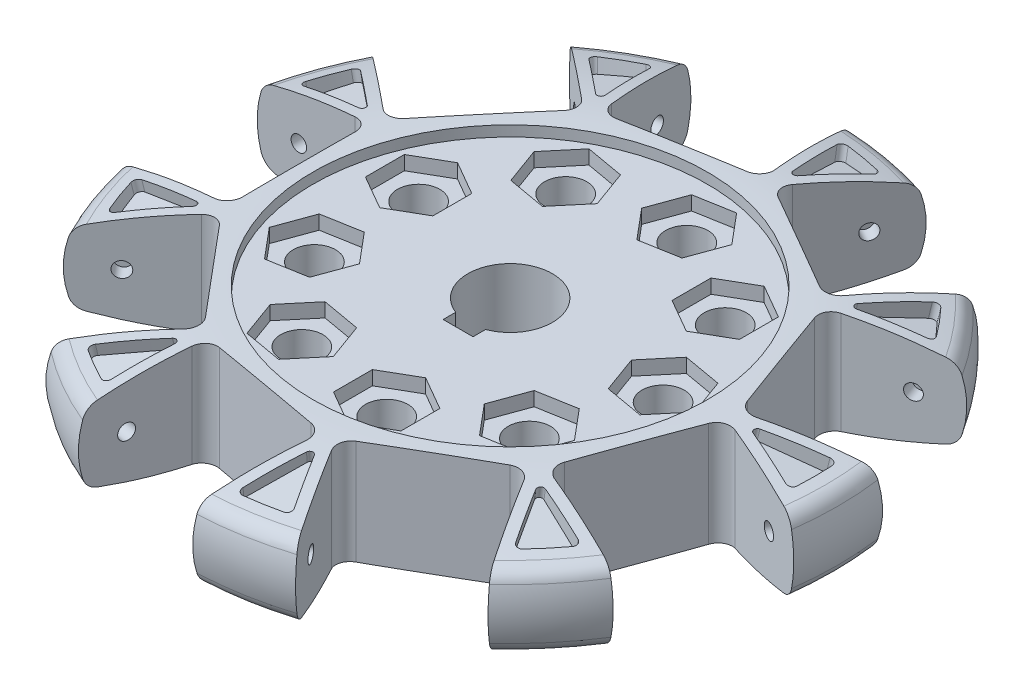
from build123d import *

# Parameters (mm, degrees)
CUT_EXTRUDE_1_DEPTH                = 69.974548261
PATTERN_CIRCULAR_1_COUNT           = 9
CUT_EXTRUDE_3_DEPTH                = 2
PATTERN_CIRCULAR_2_COUNT           = 9
PATTERN_CIRCULAR_2_COPY_1_DEPTH    = 2
PATTERN_CIRCULAR_2_COPY_2_DEPTH    = 2
PATTERN_CIRCULAR_2_COPY_3_DEPTH    = 2
PATTERN_CIRCULAR_2_COPY_4_DEPTH    = 2
PATTERN_CIRCULAR_2_COPY_5_DEPTH    = 2
PATTERN_CIRCULAR_2_COPY_6_DEPTH    = 2
PATTERN_CIRCULAR_2_COPY_7_DEPTH    = 2
PATTERN_CIRCULAR_2_COPY_8_DEPTH    = 2
SKETCH_6_R                         = 3
CUT_EXTRUDE_4_DEPTH                = 68.778705687
CUT_EXTRUDE_5_DEPTH                = 2
PATTERN_CIRCULAR_3_COUNT           = 9
CUT_EXTRUDE_6_DEPTH                = 68.778705687
CUT_EXTRUDE_6_DEPTH_BACK           = 68.778705687
SKETCH_8_W                         = 4.246385544
SKETCH_8_H                         = 1.783594452
SKETCH_9_R                         = 1.1
CUT_EXTRUDE_7_DEPTH                = 2
PATTERN_CIRCULAR_4_COUNT           = 9
PATTERN_CIRCULAR_4_COPY_1_SKETCH_R = 1.1
PATTERN_CIRCULAR_4_COPY_1_DEPTH    = 2
PATTERN_CIRCULAR_4_COPY_2_SKETCH_R = 1.1
PATTERN_CIRCULAR_4_COPY_2_DEPTH    = 2
PATTERN_CIRCULAR_4_COPY_3_SKETCH_R = 1.1
PATTERN_CIRCULAR_4_COPY_3_DEPTH    = 2
PATTERN_CIRCULAR_4_COPY_4_SKETCH_R = 1.1
PATTERN_CIRCULAR_4_COPY_4_DEPTH    = 2
PATTERN_CIRCULAR_4_COPY_5_SKETCH_R = 1.1
PATTERN_CIRCULAR_4_COPY_5_DEPTH    = 2
PATTERN_CIRCULAR_4_COPY_6_SKETCH_R = 1.1
PATTERN_CIRCULAR_4_COPY_6_DEPTH    = 2
PATTERN_CIRCULAR_4_COPY_7_SKETCH_R = 1.1
PATTERN_CIRCULAR_4_COPY_7_DEPTH    = 2
PATTERN_CIRCULAR_4_COPY_8_SKETCH_R = 1.1
PATTERN_CIRCULAR_4_COPY_8_DEPTH    = 2


with BuildPart() as part:
    # 草图1 → 旋转1 (revolve)
    with BuildSketch(Plane.XY):
        with BuildLine():
            Line((-6, 6.0015), (-6, -6.0015))
            Line((-6, -6.0015), (-28, -6.0015))
            Line((-28, -6.0015), (-28, -7.5))
            add(Edge.make_bspline(
                [(-28, -7.5), (-33.612534544, -7.506389819), (-39.182169701, -6.79075308), (-44.69778482, -5.353102439)],
                knots=[0, 0, 0, 0, 0.926994308, 0.926994308, 0.926994308, 0.926994308], degree=3))
            ThreePointArc((-44.69778482, -5.353102439), (-45.812153034, -4.7233276), (-46.46758639, -3.623855009))
            add(Edge.make_bspline(
                [(-46.473404583, 3.624485081), (-46.815442106, 2.431078638), (-47.156494807, -0.006033981), (-46.811568076, -2.419267682), (-46.46758639, -3.623855009)],
                knots=[0.139652253, 0.139652253, 0.139652253, 0.139652253, 0.501009303, 0.862385501, 0.862385501, 0.862385501, 0.862385501], degree=3))
            ThreePointArc((-46.473404583, 3.624485081), (-45.817862343, 4.722392286), (-44.70451169, 5.351348709))
            add(Edge.make_bspline(
                [(-28, 7.5), (-33.614833906, 7.506392396), (-39.186695198, 6.7901711), (-44.70451169, 5.351348709)],
                knots=[0, 0, 0, 0, 0.927371165, 0.927371165, 0.927371165, 0.927371165], degree=3))
            Line((-28, 7.5), (-28, 6.0015))
            Line((-28, 6.0015), (-6, 6.0015))
        make_face()
    revolve(axis=Axis((0, 18.348706493, 0), (0, -1, 0)))

    # 草图3 → 切除-拉伸1 (cut, through all)
    with BuildSketch(Plane(origin=(0, 11.0015, 0), x_dir=(1, 0, 0), z_dir=(0, 1, 0))):
        with BuildLine():
            Line((-46.435439053, 10), (-32, 10))
            ThreePointArc((-32, 10), (-30.585786438, 9.414213562), (-30, 8))
            Line((-30, 8), (-30, -8))
            ThreePointArc((-30, -8), (-30.585786438, -9.414213562), (-32, -10))
            Line((-32, -10), (-46.435439053, -10))
            ThreePointArc((-46.435439053, -10), (-47.5, 0), (-46.435439053, 10))
        make_face()
    cut_extrude_1 = extrude(amount=-CUT_EXTRUDE_1_DEPTH, mode=Mode.SUBTRACT)

    # 阵列(圆周)1: 切除-拉伸1 ×9 about axis
    pattern_circular_1_axis = Axis((0, 18.348706493, 0), (0, 1, 0))
    for i in range(1, PATTERN_CIRCULAR_1_COUNT):
        add(cut_extrude_1.rotate(pattern_circular_1_axis, i * 360 / PATTERN_CIRCULAR_1_COUNT), mode=Mode.SUBTRACT)

    # 草图5 → 切除-拉伸3 (cut)
    with BuildSketch(Plane(origin=(-2.912473789, 13.881841171, 0), x_dir=(-0.9786919477616355, -0.20533404828848112, -3.546150752329598e-15), z_dir=(-0.20533404828848112, 0.9786919477616355, -3.491481338843133e-15))):
        with BuildLine():
            Line((38.704667926, -11.5), (30.858037974, -11.5))
            ThreePointArc((30.858037974, -11.5), (30.374644137, -11.838841318), (30.528298333, -12.408818009))
            add(Edge.make_bspline(
                [(30.528298333, -12.408818009), (32.538191397, -14.088385517), (34.566082604, -15.757277023), (36.602034834, -17.407382848)],
                knots=[0.103336943, 0.103336943, 0.103336943, 0.103336943, 0.906001703, 0.906001703, 0.906001703, 0.906001703], degree=3))
            ThreePointArc((36.602034834, -17.407382848), (37.212548342, -17.542670381), (37.687590478, -17.136020125))
            add(Edge.make_bspline(
                [(37.687590478, -17.136020125), (38.013997426, -16.363529197), (38.622401583, -14.799746817), (39.140499829, -13.202223119), (39.376438976, -12.396783272)],
                knots=[0.134677988, 0.134677988, 0.134677988, 0.134677988, 0.5, 0.86497285, 0.86497285, 0.86497285, 0.86497285], degree=3))
            ThreePointArc((39.376438976, -12.396783272), (39.264912645, -11.78032649), (38.704667926, -11.5))
        make_face()
    cut_extrude_3 = extrude(amount=-CUT_EXTRUDE_3_DEPTH, mode=Mode.SUBTRACT)

    # 镜向1: 切除-拉伸3 across plane
    add(cut_extrude_3.mirror(Plane.ZX), mode=Mode.SUBTRACT)

    # 阵列(圆周)2: 切除-拉伸3 ×9 about axis
    pattern_circular_2_axis = Axis((0, 18.348706493, 0), (0, 1, 0))
    for i in range(1, PATTERN_CIRCULAR_2_COUNT):
        add(cut_extrude_3.rotate(pattern_circular_2_axis, i * 360 / PATTERN_CIRCULAR_2_COUNT), mode=Mode.SUBTRACT)

    # 阵列(圆周)2 copy 1 sketch → 阵列(圆周)2 copy 1 (cut)
    with BuildSketch(Plane(origin=(-2.231084362, -13.881841171, 1.872102065), x_dir=(-0.7497215281080923, 0.20533404828848112, 0.6290910577211624), z_dir=(-0.1572950066745171, -0.9786919477616355, 0.13198618208661053))):
        with BuildLine():
            Line((38.704667926, 11.5), (30.858037974, 11.5))
            ThreePointArc((30.858037974, 11.5), (30.374644137, 11.838841318), (30.528298333, 12.408818009))
            add(Edge.make_bspline(
                [(30.528298333, 12.408818009), (32.538191397, 14.088385517), (34.566082604, 15.757277023), (36.602034834, 17.407382848)],
                knots=[0.103336943, 0.103336943, 0.103336943, 0.103336943, 0.906001703, 0.906001703, 0.906001703, 0.906001703], degree=3))
            ThreePointArc((36.602034834, 17.407382848), (37.212548342, 17.542670381), (37.687590478, 17.136020125))
            add(Edge.make_bspline(
                [(37.687590478, 17.136020125), (38.013997426, 16.363529197), (38.622401583, 14.799746817), (39.140499829, 13.202223119), (39.376438976, 12.396783272)],
                knots=[0.134677988, 0.134677988, 0.134677988, 0.134677988, 0.5, 0.86497285, 0.86497285, 0.86497285, 0.86497285], degree=3))
            ThreePointArc((39.376438976, 12.396783272), (39.264912645, 11.78032649), (38.704667926, 11.5))
        make_face()
    extrude(amount=-PATTERN_CIRCULAR_2_COPY_1_DEPTH, mode=Mode.SUBTRACT)

    # 阵列(圆周)2 copy 2 sketch → 阵列(圆周)2 copy 2 (cut)
    with BuildSketch(Plane(origin=(-0.505745766, -13.881841171, 2.868226768), x_dir=(-0.16994807322611016, 0.20533404828848112, 0.9638234179662768), z_dir=(-0.03565588329827168, -0.9786919477616355, 0.2022145627118787))):
        with BuildLine():
            Line((38.704667926, 11.5), (30.858037974, 11.5))
            ThreePointArc((30.858037974, 11.5), (30.374644137, 11.838841318), (30.528298333, 12.408818009))
            add(Edge.make_bspline(
                [(30.528298333, 12.408818009), (32.538191397, 14.088385517), (34.566082604, 15.757277023), (36.602034834, 17.407382848)],
                knots=[0.103336943, 0.103336943, 0.103336943, 0.103336943, 0.906001703, 0.906001703, 0.906001703, 0.906001703], degree=3))
            ThreePointArc((36.602034834, 17.407382848), (37.212548342, 17.542670381), (37.687590478, 17.136020125))
            add(Edge.make_bspline(
                [(37.687590478, 17.136020125), (38.013997426, 16.363529197), (38.622401583, 14.799746817), (39.140499829, 13.202223119), (39.376438976, 12.396783272)],
                knots=[0.134677988, 0.134677988, 0.134677988, 0.134677988, 0.5, 0.86497285, 0.86497285, 0.86497285, 0.86497285], degree=3))
            ThreePointArc((39.376438976, 12.396783272), (39.264912645, 11.78032649), (38.704667926, 11.5))
        make_face()
    extrude(amount=-PATTERN_CIRCULAR_2_COPY_2_DEPTH, mode=Mode.SUBTRACT)

    # 阵列(圆周)2 copy 3 sketch → 阵列(圆周)2 copy 3 (cut)
    with BuildSketch(Plane(origin=(1.456236894, -13.881841171, 2.522276289), x_dir=(0.48934597388081447, 0.20533404828848112, 0.8475720892408509), z_dir=(0.10266702414423749, -0.9786919477616355, 0.17782450207972705))):
        with BuildLine():
            Line((38.704667926, 11.5), (30.858037974, 11.5))
            ThreePointArc((30.858037974, 11.5), (30.374644137, 11.838841318), (30.528298333, 12.408818009))
            add(Edge.make_bspline(
                [(30.528298333, 12.408818009), (32.538191397, 14.088385517), (34.566082604, 15.757277023), (36.602034834, 17.407382848)],
                knots=[0.103336943, 0.103336943, 0.103336943, 0.103336943, 0.906001703, 0.906001703, 0.906001703, 0.906001703], degree=3))
            ThreePointArc((36.602034834, 17.407382848), (37.212548342, 17.542670381), (37.687590478, 17.136020125))
            add(Edge.make_bspline(
                [(37.687590478, 17.136020125), (38.013997426, 16.363529197), (38.622401583, 14.799746817), (39.140499829, 13.202223119), (39.376438976, 12.396783272)],
                knots=[0.134677988, 0.134677988, 0.134677988, 0.134677988, 0.5, 0.86497285, 0.86497285, 0.86497285, 0.86497285], degree=3))
            ThreePointArc((39.376438976, 12.396783272), (39.264912645, 11.78032649), (38.704667926, 11.5))
        make_face()
    extrude(amount=-PATTERN_CIRCULAR_2_COPY_3_DEPTH, mode=Mode.SUBTRACT)

    # 阵列(圆周)2 copy 4 sketch → 阵列(圆周)2 copy 4 (cut)
    with BuildSketch(Plane(origin=(2.736830128, -13.881841171, 0.996124703), x_dir=(0.9196696013341953, 0.20533404828848112, 0.33473236024511593), z_dir=(0.19295088997278187, -0.9786919477616355, 0.0702283806252694))):
        with BuildLine():
            Line((38.704667926, 11.5), (30.858037974, 11.5))
            ThreePointArc((30.858037974, 11.5), (30.374644137, 11.838841318), (30.528298333, 12.408818009))
            add(Edge.make_bspline(
                [(30.528298333, 12.408818009), (32.538191397, 14.088385517), (34.566082604, 15.757277023), (36.602034834, 17.407382848)],
                knots=[0.103336943, 0.103336943, 0.103336943, 0.103336943, 0.906001703, 0.906001703, 0.906001703, 0.906001703], degree=3))
            ThreePointArc((36.602034834, 17.407382848), (37.212548342, 17.542670381), (37.687590478, 17.136020125))
            add(Edge.make_bspline(
                [(37.687590478, 17.136020125), (38.013997426, 16.363529197), (38.622401583, 14.799746817), (39.140499829, 13.202223119), (39.376438976, 12.396783272)],
                knots=[0.134677988, 0.134677988, 0.134677988, 0.134677988, 0.5, 0.86497285, 0.86497285, 0.86497285, 0.86497285], degree=3))
            ThreePointArc((39.376438976, 12.396783272), (39.264912645, 11.78032649), (38.704667926, 11.5))
        make_face()
    extrude(amount=-PATTERN_CIRCULAR_2_COPY_4_DEPTH, mode=Mode.SUBTRACT)

    # 阵列(圆周)2 copy 5 sketch → 阵列(圆周)2 copy 5 (cut)
    with BuildSketch(Plane(origin=(2.736830128, -13.881841171, -0.996124703), x_dir=(0.9196696013341978, 0.20533404828848112, -0.33473236024510905), z_dir=(0.19295088997278428, -0.9786919477616355, -0.0702283806252628))):
        with BuildLine():
            Line((38.704667926, 11.5), (30.858037974, 11.5))
            ThreePointArc((30.858037974, 11.5), (30.374644137, 11.838841318), (30.528298333, 12.408818009))
            add(Edge.make_bspline(
                [(30.528298333, 12.408818009), (32.538191397, 14.088385517), (34.566082604, 15.757277023), (36.602034834, 17.407382848)],
                knots=[0.103336943, 0.103336943, 0.103336943, 0.103336943, 0.906001703, 0.906001703, 0.906001703, 0.906001703], degree=3))
            ThreePointArc((36.602034834, 17.407382848), (37.212548342, 17.542670381), (37.687590478, 17.136020125))
            add(Edge.make_bspline(
                [(37.687590478, 17.136020125), (38.013997426, 16.363529197), (38.622401583, 14.799746817), (39.140499829, 13.202223119), (39.376438976, 12.396783272)],
                knots=[0.134677988, 0.134677988, 0.134677988, 0.134677988, 0.5, 0.86497285, 0.86497285, 0.86497285, 0.86497285], degree=3))
            ThreePointArc((39.376438976, 12.396783272), (39.264912645, 11.78032649), (38.704667926, 11.5))
        make_face()
    extrude(amount=-PATTERN_CIRCULAR_2_COPY_5_DEPTH, mode=Mode.SUBTRACT)

    # 阵列(圆周)2 copy 6 sketch → 阵列(圆周)2 copy 6 (cut)
    with BuildSketch(Plane(origin=(1.456236894, -13.881841171, -2.522276289), x_dir=(0.48934597388082124, 0.20533404828848112, -0.847572089240847), z_dir=(0.10266702414424368, -0.9786919477616355, -0.17782450207972347))):
        with BuildLine():
            Line((38.704667926, 11.5), (30.858037974, 11.5))
            ThreePointArc((30.858037974, 11.5), (30.374644137, 11.838841318), (30.528298333, 12.408818009))
            add(Edge.make_bspline(
                [(30.528298333, 12.408818009), (32.538191397, 14.088385517), (34.566082604, 15.757277023), (36.602034834, 17.407382848)],
                knots=[0.103336943, 0.103336943, 0.103336943, 0.103336943, 0.906001703, 0.906001703, 0.906001703, 0.906001703], degree=3))
            ThreePointArc((36.602034834, 17.407382848), (37.212548342, 17.542670381), (37.687590478, 17.136020125))
            add(Edge.make_bspline(
                [(37.687590478, 17.136020125), (38.013997426, 16.363529197), (38.622401583, 14.799746817), (39.140499829, 13.202223119), (39.376438976, 12.396783272)],
                knots=[0.134677988, 0.134677988, 0.134677988, 0.134677988, 0.5, 0.86497285, 0.86497285, 0.86497285, 0.86497285], degree=3))
            ThreePointArc((39.376438976, 12.396783272), (39.264912645, 11.78032649), (38.704667926, 11.5))
        make_face()
    extrude(amount=-PATTERN_CIRCULAR_2_COPY_6_DEPTH, mode=Mode.SUBTRACT)

    # 阵列(圆周)2 copy 7 sketch → 阵列(圆周)2 copy 7 (cut)
    with BuildSketch(Plane(origin=(-0.505745766, -13.881841171, -2.868226768), x_dir=(-0.16994807322610272, 0.20533404828848112, -0.9638234179662782), z_dir=(-0.035655883298264704, -0.9786919477616355, -0.20221456271187993))):
        with BuildLine():
            Line((38.704667926, 11.5), (30.858037974, 11.5))
            ThreePointArc((30.858037974, 11.5), (30.374644137, 11.838841318), (30.528298333, 12.408818009))
            add(Edge.make_bspline(
                [(30.528298333, 12.408818009), (32.538191397, 14.088385517), (34.566082604, 15.757277023), (36.602034834, 17.407382848)],
                knots=[0.103336943, 0.103336943, 0.103336943, 0.103336943, 0.906001703, 0.906001703, 0.906001703, 0.906001703], degree=3))
            ThreePointArc((36.602034834, 17.407382848), (37.212548342, 17.542670381), (37.687590478, 17.136020125))
            add(Edge.make_bspline(
                [(37.687590478, 17.136020125), (38.013997426, 16.363529197), (38.622401583, 14.799746817), (39.140499829, 13.202223119), (39.376438976, 12.396783272)],
                knots=[0.134677988, 0.134677988, 0.134677988, 0.134677988, 0.5, 0.86497285, 0.86497285, 0.86497285, 0.86497285], degree=3))
            ThreePointArc((39.376438976, 12.396783272), (39.264912645, 11.78032649), (38.704667926, 11.5))
        make_face()
    extrude(amount=-PATTERN_CIRCULAR_2_COPY_7_DEPTH, mode=Mode.SUBTRACT)

    # 阵列(圆周)2 copy 8 sketch → 阵列(圆周)2 copy 8 (cut)
    with BuildSketch(Plane(origin=(-2.231084362, -13.881841171, -1.872102065), x_dir=(-0.7497215281080875, 0.20533404828848112, -0.629091057721168), z_dir=(-0.15729500667451257, -0.9786919477616355, -0.13198618208661594))):
        with BuildLine():
            Line((38.704667926, 11.5), (30.858037974, 11.5))
            ThreePointArc((30.858037974, 11.5), (30.374644137, 11.838841318), (30.528298333, 12.408818009))
            add(Edge.make_bspline(
                [(30.528298333, 12.408818009), (32.538191397, 14.088385517), (34.566082604, 15.757277023), (36.602034834, 17.407382848)],
                knots=[0.103336943, 0.103336943, 0.103336943, 0.103336943, 0.906001703, 0.906001703, 0.906001703, 0.906001703], degree=3))
            ThreePointArc((36.602034834, 17.407382848), (37.212548342, 17.542670381), (37.687590478, 17.136020125))
            add(Edge.make_bspline(
                [(37.687590478, 17.136020125), (38.013997426, 16.363529197), (38.622401583, 14.799746817), (39.140499829, 13.202223119), (39.376438976, 12.396783272)],
                knots=[0.134677988, 0.134677988, 0.134677988, 0.134677988, 0.5, 0.86497285, 0.86497285, 0.86497285, 0.86497285], degree=3))
            ThreePointArc((39.376438976, 12.396783272), (39.264912645, 11.78032649), (38.704667926, 11.5))
        make_face()
    extrude(amount=-PATTERN_CIRCULAR_2_COPY_8_DEPTH, mode=Mode.SUBTRACT)

    # 草图6 → 切除-拉伸4 (cut, through all)
    with BuildSketch(Plane(origin=(0, 6.0015, 0), x_dir=(1, 0, 0), z_dir=(0, 1, 0))):
        with Locations((3.800515938, -21.328883195)):
            Circle(SKETCH_6_R)
    cut_extrude_4 = extrude(amount=-CUT_EXTRUDE_4_DEPTH, mode=Mode.SUBTRACT)

    # 草图7 → 切除-拉伸5 (cut)
    with BuildSketch(Plane(origin=(0, 6.0015, 0), x_dir=(1, 0, 0), z_dir=(0, 1, 0))):
        Polygon((-0.984274418, -24.091383195), (3.800515938, -26.853883195), (8.585306294, -24.091383195), (8.585306294, -18.566383195), (3.800515938, -15.803883195), (-0.984274418, -18.566383195), align=None)
    cut_extrude_5 = extrude(amount=-CUT_EXTRUDE_5_DEPTH, mode=Mode.SUBTRACT)

    # 阵列(圆周)3: 切除-拉伸4, 切除-拉伸5 ×9 about axis
    pattern_circular_3_axis = Axis((0, 18.348706493, 0), (0, 1, 0))
    add([cut_extrude_4.rotate(pattern_circular_3_axis, i * 360 / PATTERN_CIRCULAR_3_COUNT) for i in range(1, PATTERN_CIRCULAR_3_COUNT)], mode=Mode.SUBTRACT)
    add([cut_extrude_5.rotate(pattern_circular_3_axis, i * 360 / PATTERN_CIRCULAR_3_COUNT) for i in range(1, PATTERN_CIRCULAR_3_COUNT)], mode=Mode.SUBTRACT)

    # 草图8 → 切除-拉伸6 (cut, two sides: drawn at the far end of the back side and taken through both)
    with BuildSketch(Plane(origin=(0, 6.0015, 0), x_dir=(1, 0, 0), z_dir=(0, 1, 0)).offset(-CUT_EXTRUDE_6_DEPTH_BACK)):
        with Locations((0, -6.503575238)):
            Rectangle(SKETCH_8_W, SKETCH_8_H)
    extrude(amount=CUT_EXTRUDE_6_DEPTH + CUT_EXTRUDE_6_DEPTH_BACK, mode=Mode.SUBTRACT)

    # 草图9 → 切除-拉伸7 (cut)
    with BuildSketch(Plane(origin=(9.84807753, 0, 1.736481777), x_dir=(-0.17364817766693996, 0, 0.9848077530122064), z_dir=(-0.9848077530122064, 0, -0.17364817766693996))):
        with Locations((40, 0)):
            Circle(SKETCH_9_R)
    cut_extrude_7 = extrude(amount=-CUT_EXTRUDE_7_DEPTH, mode=Mode.SUBTRACT)

    # 镜向5: 切除-拉伸7 across plane
    add(cut_extrude_7.mirror(Plane(origin=(0, 0, 0), x_dir=(-0.17364817766694024, 0, 0.9848077530122062), z_dir=(-0.9848077530122064, 0, -0.17364817766694024))), mode=Mode.SUBTRACT)

    # 阵列(圆周)4: 切除-拉伸7 ×9 about axis
    pattern_circular_4_axis = Axis((0, 18.348706493, 0), (0, 1, 0))
    for i in range(1, PATTERN_CIRCULAR_4_COUNT):
        add(cut_extrude_7.rotate(pattern_circular_4_axis, i * 360 / PATTERN_CIRCULAR_4_COUNT), mode=Mode.SUBTRACT)

    # 阵列(圆周)4 copy 1 sketch → 阵列(圆周)4 copy 1 (cut)
    with BuildSketch(Plane(origin=(-8.660254038, 0, 5), x_dir=(0.499999999999991, 0, 0.8660254037844437), z_dir=(0.866025403784444, 0, -0.4999999999999911))):
        with Locations((40, 0)):
            Circle(PATTERN_CIRCULAR_4_COPY_1_SKETCH_R)
    extrude(amount=-PATTERN_CIRCULAR_4_COPY_1_DEPTH, mode=Mode.SUBTRACT)

    # 阵列(圆周)4 copy 2 sketch → 阵列(圆周)4 copy 2 (cut)
    with BuildSketch(Plane(origin=(-3.420201433, 0, 9.396926208), x_dir=(0.9396926207859049, 0, 0.34202014332567854), z_dir=(0.34202014332567854, 0, -0.9396926207859051))):
        with Locations((40, 0)):
            Circle(PATTERN_CIRCULAR_4_COPY_2_SKETCH_R)
    extrude(amount=-PATTERN_CIRCULAR_4_COPY_2_DEPTH, mode=Mode.SUBTRACT)

    # 阵列(圆周)4 copy 3 sketch → 阵列(圆周)4 copy 3 (cut)
    with BuildSketch(Plane(origin=(3.420201433, 0, 9.396926208), x_dir=(0.939692620785912, 0, -0.34202014332565883), z_dir=(-0.3420201433256589, 0, -0.9396926207859122))):
        with Locations((40, 0)):
            Circle(PATTERN_CIRCULAR_4_COPY_3_SKETCH_R)
    extrude(amount=-PATTERN_CIRCULAR_4_COPY_3_DEPTH, mode=Mode.SUBTRACT)

    # 阵列(圆周)4 copy 4 sketch → 阵列(圆周)4 copy 4 (cut)
    with BuildSketch(Plane(origin=(8.660254038, 0, 5), x_dir=(0.500000000000009, 0, -0.8660254037844334), z_dir=(-0.8660254037844336, 0, -0.5000000000000091))):
        with Locations((40, 0)):
            Circle(PATTERN_CIRCULAR_4_COPY_4_SKETCH_R)
    extrude(amount=-PATTERN_CIRCULAR_4_COPY_4_DEPTH, mode=Mode.SUBTRACT)

    # 阵列(圆周)4 copy 5 sketch → 阵列(圆周)4 copy 5 (cut)
    with BuildSketch(Plane(origin=(9.84807753, 0, -1.736481777), x_dir=(-0.1736481776669201, 0, -0.9848077530122098), z_dir=(-0.9848077530122101, 0, 0.17364817766692017))):
        with Locations((40, 0)):
            Circle(PATTERN_CIRCULAR_4_COPY_5_SKETCH_R)
    extrude(amount=-PATTERN_CIRCULAR_4_COPY_5_DEPTH, mode=Mode.SUBTRACT)

    # 阵列(圆周)4 copy 6 sketch → 阵列(圆周)4 copy 6 (cut)
    with BuildSketch(Plane(origin=(6.427876097, 0, -7.660444431), x_dir=(-0.766044443118971, 0, -0.6427876096865477), z_dir=(-0.6427876096865478, 0, 0.7660444431189712))):
        with Locations((40, 0)):
            Circle(PATTERN_CIRCULAR_4_COPY_6_SKETCH_R)
    extrude(amount=-PATTERN_CIRCULAR_4_COPY_6_DEPTH, mode=Mode.SUBTRACT)

    # 阵列(圆周)4 copy 7 sketch → 阵列(圆周)4 copy 7 (cut)
    with BuildSketch(Plane(origin=(0, 0, -10), x_dir=(-1, 0, 0), z_dir=(0, 0, 1))):
        with Locations((40, 0)):
            Circle(PATTERN_CIRCULAR_4_COPY_7_SKETCH_R)
    extrude(amount=-PATTERN_CIRCULAR_4_COPY_7_DEPTH, mode=Mode.SUBTRACT)

    # 阵列(圆周)4 copy 8 sketch → 阵列(圆周)4 copy 8 (cut)
    with BuildSketch(Plane(origin=(-6.427876097, 0, -7.660444431), x_dir=(-0.7660444431189848, 0, 0.6427876096865313), z_dir=(0.6427876096865313, 0, 0.766044443118985))):
        with Locations((40, 0)):
            Circle(PATTERN_CIRCULAR_4_COPY_8_SKETCH_R)
    extrude(amount=-PATTERN_CIRCULAR_4_COPY_8_DEPTH, mode=Mode.SUBTRACT)


solid = part.part
